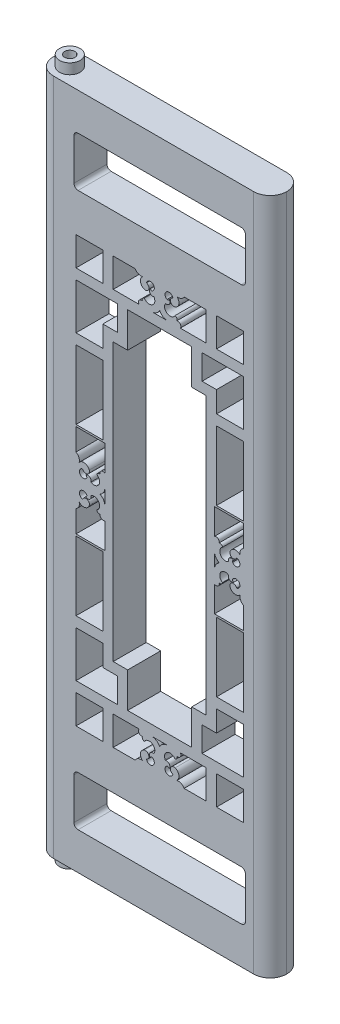
from build123d import *

# Parameters (mm, degrees)
SKETCH1_W            = 595
SKETCH1_H            = 1640
BOSS_EXTRUDE1_DEPTH  = 180
SKETCH_6_W           = 595
SKETCH_6_H           = 1640
CUT_EXTRUDE_2_DEPTH  = 100
CUT_EXTRUDE_3_DEPTH  = 100
SKETCH2_W            = 65
SKETCH2_H            = 70
SKETCH2_H_2          = 167
CUT_EXTRUDE_5_DEPTH  = 1747.432077122
CUT_EXTRUDE_8_DEPTH  = 1747.432077122
FILLET_1_R           = 40
SKETCH_7_R           = 25
EXTRUDE_1_DEPTH      = 25
SKETCH_8_R           = 12.5
CUT_EXTRUDE_9_DEPTH  = 1794.46731222
SKETCH_9_W           = 80
SKETCH_9_H           = 1640
CUT_EXTRUDE_10_DEPTH = 30
FILLET_2_R           = 40


with BuildPart() as part:
    # Sketch1 → Boss-Extrude1 (new body)
    with BuildSketch(Plane.XY):
        with Locations((297.5, 820)):
            Rectangle(SKETCH1_W, SKETCH1_H)
    extrude(amount=BOSS_EXTRUDE1_DEPTH)

    # 草图6 → 切除-拉伸2 (cut)
    with BuildSketch(Plane.XY.offset(180)):
        with Locations((297.5, 820)):
            Rectangle(SKETCH_6_W, SKETCH_6_H)
    extrude(amount=-CUT_EXTRUDE_2_DEPTH, mode=Mode.SUBTRACT)

    # 草图1 → 切除-拉伸3 (cut)
    with BuildSketch(Plane(origin=(0, 0, 0), x_dir=(-1, 0, 0), z_dir=(0, 0, -1))):
        with BuildLine():
            ThreePointArc((-339.478697135, 363.442307012), (-347.464207716, 366.462464977), (-347.449072001, 375))
            Line((-347.449072001, 375), (-410, 375))
            Line((-410, 375), (-410, 305))
            Line((-410, 305), (-356.673331708, 305))
            ThreePointArc((-356.673331708, 305), (-348.94904931, 312.012889726), (-338.529552639, 312.541330816))
            ThreePointArc((-338.529552639, 312.541330816), (-344.046220029, 325.924483031), (-334.768909443, 337.036363636))
            ThreePointArc((-334.768909443, 337.036363636), (-323.949287324, 331.726907665), (-329.315168468, 320.935157804))
            ThreePointArc((-329.315168468, 320.935157804), (-314.478603669, 315.069270244), (-315.214046212, 331.006378394))
            ThreePointArc((-315.214046212, 331.006378394), (-318.365986632, 330.765395418), (-320.358708006, 328.311447022))
            ThreePointArc((-320.358708006, 328.311447022), (-320.882047686, 338.069212343), (-311.577227356, 341.053870966))
            ThreePointArc((-311.577227356, 341.053870966), (-311.192434776, 341.798442865), (-310.72696898, 342.495432272))
            ThreePointArc((-310.72696898, 342.495432272), (-316.343126273, 360.498534643), (-334.477239272, 355.321000146))
            ThreePointArc((-334.477239272, 355.321000146), (-338.751843962, 358.289222889), (-339.478697135, 363.442307012))
        make_face()
        with BuildLine():
            Line((-185, 375), (-247.550927999, 375))
            ThreePointArc((-247.550927999, 375), (-247.535792284, 366.462464977), (-255.521302865, 363.442307012))
            ThreePointArc((-255.521302865, 363.442307012), (-256.248156038, 358.289222889), (-260.522760728, 355.321000146))
            ThreePointArc((-260.522760728, 355.321000146), (-278.656873727, 360.498534643), (-284.27303102, 342.495432272))
            ThreePointArc((-284.27303102, 342.495432272), (-283.807565224, 341.798442865), (-283.422772644, 341.053870966))
            ThreePointArc((-283.422772644, 341.053870966), (-274.117952314, 338.069212343), (-274.641291994, 328.311447022))
            ThreePointArc((-274.641291994, 328.311447022), (-276.634013368, 330.765395418), (-279.785953788, 331.006378394))
            ThreePointArc((-279.785953788, 331.006378394), (-280.521396331, 315.069270244), (-265.684831532, 320.935157804))
            ThreePointArc((-265.684831532, 320.935157804), (-271.050712676, 331.726907665), (-260.231090557, 337.036363636))
            ThreePointArc((-260.231090557, 337.036363636), (-250.953779971, 325.924483031), (-256.470447361, 312.541330816))
            ThreePointArc((-256.470447361, 312.541330816), (-246.05095069, 312.012889726), (-238.326668292, 305))
            Line((-238.326668292, 305), (-185, 305))
            Line((-185, 305), (-185, 375))
        make_face()
        with BuildLine():
            ThreePointArc((-279.5, 375), (-290.126074317, 371.412833197), (-297.5, 362.9626))
            ThreePointArc((-297.5, 362.9626), (-304.873925683, 371.412833197), (-315.5, 375))
            Line((-315.5, 375), (-279.5, 375))
        make_face()
    cut_extrude_3 = extrude(amount=-CUT_EXTRUDE_3_DEPTH, mode=Mode.SUBTRACT)

    # Sketch2 → 切除-拉伸5 (cut, through all)
    with BuildSketch(Plane(origin=(0, 0, 0), x_dir=(-1, 0, 0), z_dir=(0, 0, -1))):
        with BuildLine():
            Line((-100, 90), (-495, 90))
            ThreePointArc((-495, 90), (-502.071067812, 92.928932188), (-505, 100))
            Line((-505, 100), (-505, 200))
            ThreePointArc((-505, 200), (-502.071067812, 207.071067812), (-495, 210))
            Line((-495, 210), (-100, 210))
            ThreePointArc((-100, 210), (-92.928932188, 207.071067812), (-90, 200))
            Line((-90, 200), (-90, 100))
            ThreePointArc((-90, 100), (-92.928932188, 92.928932188), (-100, 90))
        make_face()
        with Locations((-467.5, 340)):
            Rectangle(SKETCH2_W, SKETCH2_H)
        with Locations((-127.5, 340)):
            Rectangle(SKETCH2_W, SKETCH2_H)
        Polygon((-435, 511), (-500, 511), (-500, 400), (-400, 400), (-400, 460), (-435, 460), align=None)
        Polygon((-195, 460), (-195, 400), (-95, 400), (-95, 511), (-160, 511), (-160, 460), align=None)
        with Locations((-467.5, 619.5)):
            Rectangle(SKETCH2_W, SKETCH2_H_2)
        with Locations((-127.5, 619.5)):
            Rectangle(SKETCH2_W, SKETCH2_H_2)
        Polygon((-220, 1240), (-375, 1240), (-375, 1155), (-410, 1155), (-410, 485), (-375, 485), (-375, 400), (-220, 400), (-220, 485), (-185, 485), (-185, 1155), (-220, 1155), align=None)
        with Locations((-467.5, 1020.5)):
            Rectangle(SKETCH2_W, SKETCH2_H_2)
        with Locations((-127.5, 1020.5)):
            Rectangle(SKETCH2_W, SKETCH2_H_2)
        Polygon((-95, 1240), (-195, 1240), (-195, 1180), (-160, 1180), (-160, 1129), (-95, 1129), align=None)
        with Locations((-127.5, 1300)):
            Rectangle(SKETCH2_W, SKETCH2_H)
        with Locations((-467.5, 1300)):
            Rectangle(SKETCH2_W, SKETCH2_H)
        Polygon((-400, 1240), (-500, 1240), (-500, 1129), (-435, 1129), (-435, 1180), (-400, 1180), align=None)
        with BuildLine():
            Line((-495, 1430), (-100, 1430))
            ThreePointArc((-100, 1430), (-92.928932188, 1432.928932188), (-90, 1440))
            Line((-90, 1440), (-90, 1540))
            ThreePointArc((-90, 1540), (-92.928932188, 1547.071067812), (-100, 1550))
            Line((-100, 1550), (-495, 1550))
            ThreePointArc((-495, 1550), (-502.071067812, 1547.071067812), (-505, 1540))
            Line((-505, 1540), (-505, 1440))
            ThreePointArc((-505, 1440), (-502.071067812, 1432.928932188), (-495, 1430))
        make_face()
    extrude(amount=-CUT_EXTRUDE_5_DEPTH, mode=Mode.SUBTRACT)

    # 镜向1: 切除-拉伸3 across plane
    add(cut_extrude_3.mirror(Plane.ZX.offset(820)), mode=Mode.SUBTRACT)

    # 草图1<5> → 切除-拉伸8 (cut, through all)
    with BuildSketch(Plane(origin=(0, 0, 0), x_dir=(-1, 0, 0), z_dir=(0, 0, -1))):
        with BuildLine():
            Line((-430, 869.949072001), (-430, 932.5))
            Line((-430, 932.5), (-500, 932.5))
            Line((-500, 932.5), (-500, 879.173331708))
            ThreePointArc((-500, 879.173331708), (-492.987110274, 871.44904931), (-492.458669184, 861.029552639))
            ThreePointArc((-492.458669184, 861.029552639), (-479.075516969, 866.546220029), (-467.963636364, 857.268909443))
            ThreePointArc((-467.963636364, 857.268909443), (-473.273092335, 846.449287324), (-484.064842196, 851.815168468))
            ThreePointArc((-484.064842196, 851.815168468), (-489.930729756, 836.978603669), (-473.993621606, 837.714046212))
            ThreePointArc((-473.993621606, 837.714046212), (-474.234604582, 840.865986631), (-476.688552978, 842.858708006))
            ThreePointArc((-476.688552978, 842.858708006), (-466.930787657, 843.382047686), (-463.946129034, 834.077227356))
            ThreePointArc((-463.946129034, 834.077227356), (-463.201557135, 833.692434776), (-462.504567728, 833.22696898))
            ThreePointArc((-462.504567728, 833.22696898), (-444.501465357, 838.843126273), (-449.678999854, 856.977239272))
            ThreePointArc((-449.678999854, 856.977239272), (-446.710777111, 861.251843962), (-441.557692988, 861.978697135))
            ThreePointArc((-441.557692988, 861.978697135), (-438.537535023, 869.964207716), (-430, 869.949072001))
        make_face()
        with BuildLine():
            Line((-500, 760.826668292), (-500, 707.5))
            Line((-500, 707.5), (-430, 707.5))
            Line((-430, 707.5), (-430, 770.050927999))
            ThreePointArc((-430, 770.050927999), (-438.537535023, 770.035792284), (-441.557692988, 778.021302865))
            ThreePointArc((-441.557692988, 778.021302865), (-446.710777111, 778.748156038), (-449.678999854, 783.022760728))
            ThreePointArc((-449.678999854, 783.022760728), (-444.501465357, 801.156873727), (-462.504567728, 806.77303102))
            ThreePointArc((-462.504567728, 806.77303102), (-463.201557135, 806.307565224), (-463.946129034, 805.922772644))
            ThreePointArc((-463.946129034, 805.922772644), (-466.930787657, 796.617952314), (-476.688552978, 797.141291994))
            ThreePointArc((-476.688552978, 797.141291994), (-474.234604582, 799.134013368), (-473.993621606, 802.285953788))
            ThreePointArc((-473.993621606, 802.285953788), (-489.930729756, 803.021396331), (-484.064842196, 788.184831532))
            ThreePointArc((-484.064842196, 788.184831532), (-473.273092335, 793.550712676), (-467.963636364, 782.731090557))
            ThreePointArc((-467.963636364, 782.731090557), (-479.075516969, 773.453779971), (-492.458669184, 778.970447361))
            ThreePointArc((-492.458669184, 778.970447361), (-492.987110274, 768.55095069), (-500, 760.826668292))
        make_face()
        with BuildLine():
            ThreePointArc((-442.0374, 820), (-433.587166803, 827.373925683), (-430, 838))
            Line((-430, 838), (-430, 802))
            ThreePointArc((-430, 802), (-433.587166803, 812.626074317), (-442.0374, 820))
        make_face()
    cut_extrude_8 = extrude(amount=-CUT_EXTRUDE_8_DEPTH, mode=Mode.SUBTRACT)

    # 镜向3: 切除-拉伸8 across plane
    add(cut_extrude_8.mirror(Plane.ZY.offset(-297.5)), mode=Mode.SUBTRACT)

    # 圆角1
    fillet_1_edges = [part.edges().sort_by_distance(p)[0] for p in [
        (0, 820, 0),
        (0, 820, 80),
    ]]
    fillet(fillet_1_edges, radius=FILLET_1_R - 0.0001)  # a hair under: the kernel refuses the full size

    # 草图7 → 凸台-拉伸1 (add)
    with BuildSketch(Plane(origin=(0, 1640, 0), x_dir=(1, 0, 0), z_dir=(0, 1, 0))):
        with Locations(Location((40, -40, 0), (0, 0, 90))):
            Circle(SKETCH_7_R)
    extrude_1 = extrude(amount=EXTRUDE_1_DEPTH)

    # 镜向4: 凸台-拉伸1 across plane
    add(extrude_1.mirror(Plane.ZX.offset(820)))

    # 草图8 → 切除-拉伸9 (cut, through all)
    with BuildSketch(Plane(origin=(0, 1665, 0), x_dir=(1, 0, 0), z_dir=(0, 1, 0))):
        with Locations(Location((40, -40, 0), (0, 0, 270))):
            Circle(SKETCH_8_R)
    extrude(amount=-CUT_EXTRUDE_9_DEPTH, mode=Mode.SUBTRACT)

    # 草图9 → 切除-拉伸10 (cut)
    with BuildSketch(Plane(origin=(595, 0, 0), x_dir=(0, 0, -1), z_dir=(1, 0, 0))):
        with Locations((-40, 820)):
            Rectangle(SKETCH_9_W, SKETCH_9_H)
    extrude(amount=-CUT_EXTRUDE_10_DEPTH, mode=Mode.SUBTRACT)

    # 圆角2
    fillet_2_edges = [part.edges().sort_by_distance(p)[0] for p in [
        (565, 820, 0),
        (565, 820, 80),
    ]]
    fillet(fillet_2_edges, radius=FILLET_2_R - 0.0001)  # a hair under: the kernel refuses the full size


solid = part.part
